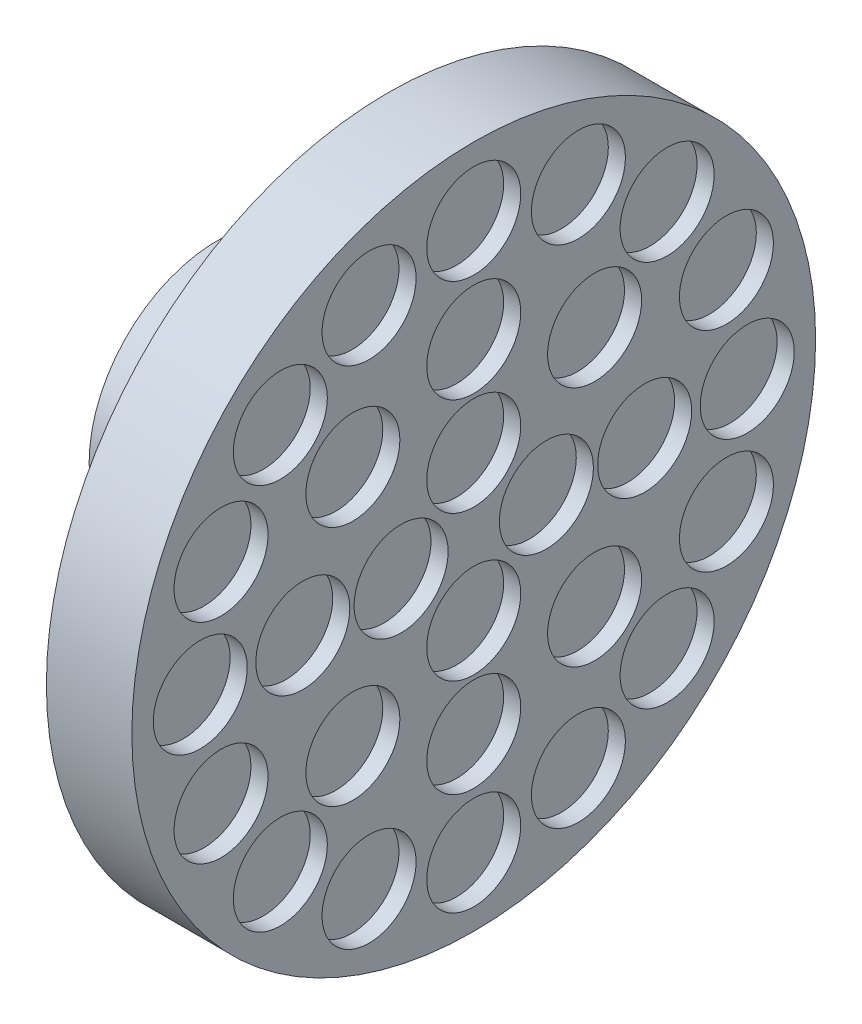
from build123d import *

# Parameters (mm, degrees)
ESQUISSE1_R             = 40
BOSS_EXTRU_2_DEPTH      = 10
ESQUISSE5_R             = 5.5
ENL_V_MAT_EXTRU_2_DEPTH = 2
ESQUISSE6_R             = 15
BOSS_EXTRU_3_DEPTH      = 20
CONG_1_R                = 10
ESQUISSE7_R             = 5
ENL_V_MAT_EXTRU_3_DEPTH = 16


with BuildPart() as part:
    # Esquisse1 → Boss.-Extru.2 (new body)
    with BuildSketch(Plane.YZ):
        Circle(ESQUISSE1_R)
    extrude(amount=BOSS_EXTRU_2_DEPTH)

    # Esquisse5 → Enlèv. mat.-Extru.2 (cut)
    with BuildSketch(Plane.YZ.offset(10)):
        with Locations((0, 32)):
            Circle(ESQUISSE5_R)
        with Locations((12.245869836, 29.56414504)):
            Circle(ESQUISSE5_R)
        with Locations((22.627416998, 22.627416998)):
            Circle(ESQUISSE5_R)
        with Locations((29.56414504, 12.245869836)):
            Circle(ESQUISSE5_R)
        with Locations((32, 0)):
            Circle(ESQUISSE5_R)
        with Locations((29.56414504, -12.245869836)):
            Circle(ESQUISSE5_R)
        with Locations((22.627416998, -22.627416998)):
            Circle(ESQUISSE5_R)
        with Locations((12.245869836, -29.56414504)):
            Circle(ESQUISSE5_R)
        with Locations((0, -32)):
            Circle(ESQUISSE5_R)
        with Locations((-12.245869836, -29.56414504)):
            Circle(ESQUISSE5_R)
        with Locations((-22.627416998, -22.627416998)):
            Circle(ESQUISSE5_R)
        with Locations((-29.56414504, -12.245869836)):
            Circle(ESQUISSE5_R)
        with Locations((-32, 0)):
            Circle(ESQUISSE5_R)
        with Locations((-29.56414504, 12.245869836)):
            Circle(ESQUISSE5_R)
        with Locations((-22.627416998, 22.627416998)):
            Circle(ESQUISSE5_R)
        with Locations((-12.245869836, 29.56414504)):
            Circle(ESQUISSE5_R)
        with Locations((0, 20)):
            Circle(ESQUISSE5_R)
        with Locations((14.142135624, 14.142135624)):
            Circle(ESQUISSE5_R)
        with Locations((20, 0)):
            Circle(ESQUISSE5_R)
        with Locations((14.142135624, -14.142135624)):
            Circle(ESQUISSE5_R)
        with Locations((0, -20)):
            Circle(ESQUISSE5_R)
        with Locations((-14.142135624, -14.142135624)):
            Circle(ESQUISSE5_R)
        with Locations((-20, 0)):
            Circle(ESQUISSE5_R)
        with Locations((-14.142135624, 14.142135624)):
            Circle(ESQUISSE5_R)
        with Locations((0, 8.5)):
            Circle(ESQUISSE5_R)
        with Locations((8.5, 0)):
            Circle(ESQUISSE5_R)
        with Locations((0, -8.5)):
            Circle(ESQUISSE5_R)
        with Locations((-8.5, 0)):
            Circle(ESQUISSE5_R)
    extrude(amount=-ENL_V_MAT_EXTRU_2_DEPTH, mode=Mode.SUBTRACT)

    # Esquisse6 → Boss.-Extru.3 (add)
    with BuildSketch(Plane(origin=(0, 0, 0), x_dir=(0, -1, 0), z_dir=(-1, 0, 0))):
        Circle(ESQUISSE6_R)
    extrude(amount=BOSS_EXTRU_3_DEPTH)

    # Congé1
    cong_1_edges = [part.edges().sort_by_distance(p)[0] for p in [
        (0, 15, 0),
    ]]
    fillet(cong_1_edges, radius=CONG_1_R)

    # Esquisse7 → Enlèv. mat.-Extru.3 (cut)
    with BuildSketch(Plane.ZY.offset(20)):
        Circle(ESQUISSE7_R)
    extrude(amount=-ENL_V_MAT_EXTRU_3_DEPTH, mode=Mode.SUBTRACT)


solid = part.part
